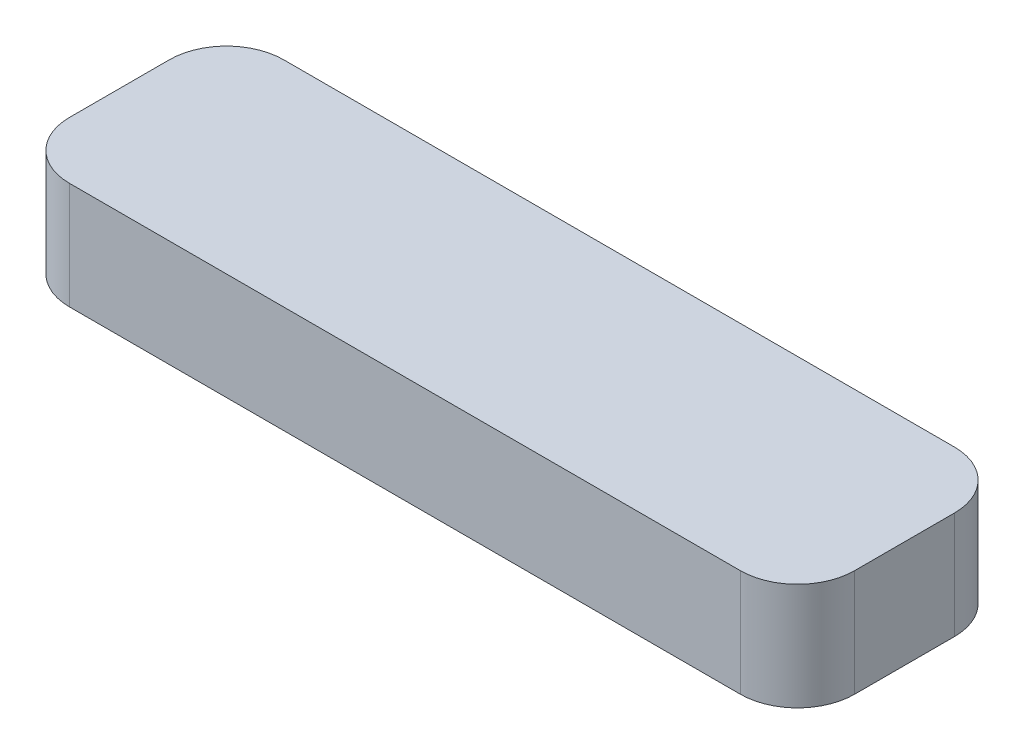
from build123d import *

# Parameters (mm, degrees)
SKETCH1_W           = 110
SKETCH1_H           = 30
BOSS_EXTRUDE1_DEPTH = 15
FILLET2_R           = 8


with BuildPart() as part:
    # Sketch1 → Boss-Extrude1 (new body)
    with BuildSketch(Plane(origin=(0, 0, 0), x_dir=(1, 0, 0), z_dir=(0, 1, 0))):
        with Locations((8.243243243, 3.108108108)):
            Rectangle(SKETCH1_W, SKETCH1_H)
    extrude(amount=BOSS_EXTRUDE1_DEPTH)

    # Fillet2
    fillet2_edges = [part.edges().sort_by_distance(p)[0] for p in [
        (63.243243243, 7.5, -18.108108108),
        (63.243243243, 7.5, 11.891891892),
        (-46.756756757, 7.5, -18.108108108),
        (-46.756756757, 7.5, 11.891891892),
    ]]
    fillet(fillet2_edges, radius=FILLET2_R)


solid = part.part
